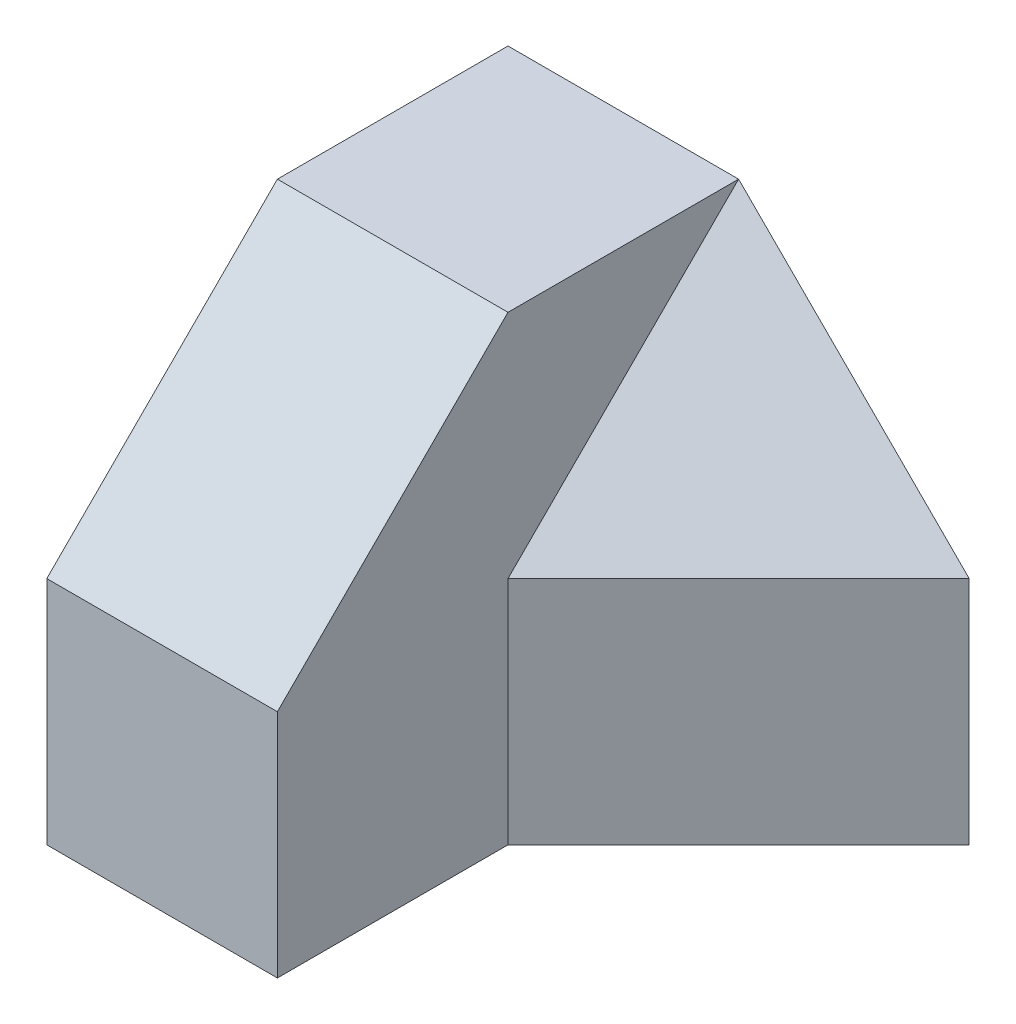
from build123d import *

# Parameters (mm, degrees)
SKETCH2_W           = 4
SKETCH2_H           = 4
BOSS_EXTRUDE1_DEPTH = 4
CUT_EXTRUDE1_DEPTH  = 4
CUT_EXTRUDE2_DEPTH  = 4
CHAMFER1_SIZE       = 2
CUT_EXTRUDE4_DEPTH  = 4


with BuildPart() as part:
    # Sketch2 → Boss-Extrude1 (new body)
    with BuildSketch(Plane(origin=(0, 0, 0), x_dir=(0, 0, -1), z_dir=(1, 0, 0))):
        Rectangle(SKETCH2_W, SKETCH2_H)
    extrude(amount=BOSS_EXTRUDE1_DEPTH)

    # Sketch3 → Cut-Extrude1 (cut)
    with BuildSketch(Plane.XY.offset(2)):
        Polygon((2, 2), (4, 0), (4, 2), align=None)
    extrude(amount=-CUT_EXTRUDE1_DEPTH, mode=Mode.SUBTRACT)

    # Sketch4 → Cut-Extrude2 (cut)
    with BuildSketch(Plane(origin=(0, 2, 0), x_dir=(1, 0, 0), z_dir=(0, 1, 0))):
        Polygon((2, 0), (4, 2), (4, -2), (2, -2), align=None)
    extrude(amount=-CUT_EXTRUDE2_DEPTH, mode=Mode.SUBTRACT)

    # Chamfer1
    chamfer1_edges = [part.edges().sort_by_distance(p)[0] for p in [
        (1, 2, 2),
    ]]
    chamfer(chamfer1_edges, length=CHAMFER1_SIZE)

    # 3DSketch1 → Cut-Extrude4 (cut, along a direction that is not the sketch's normal)
    with BuildSketch(Plane(origin=(2, 0, 0), x_dir=(0.7071067811865476, 0, -0.7071067811865476), z_dir=(0.5773502691896258, 0.5773502691896258, 0.5773502691896258))):
        Polygon((0, 0), (2.828427125, 0), (1.414213562, 2.449489743), align=None)
    extrude(amount=CUT_EXTRUDE4_DEPTH, dir=(0, 1, 0), mode=Mode.SUBTRACT)


solid = part.part
